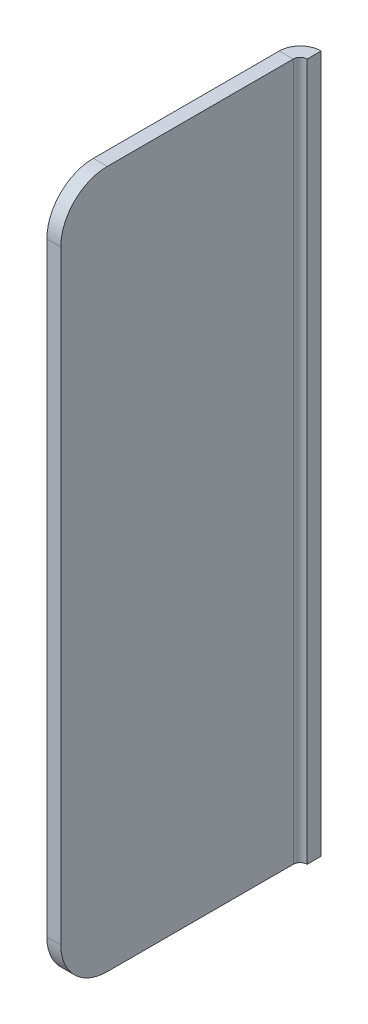
from build123d import *

# Parameters (mm, degrees)
SKETCH_3_W = 6
SKETCH_3_H = 300
FILLET_1_R = 20


with BuildPart() as part:
    # 扫描1: sweep along a path in 草图2
    with BuildLine(Plane(origin=(0, 0, 0), x_dir=(1, 0, 0), z_dir=(0, 1, 0))) as sweep_1_path:
        Line((0, 0), (0, 100))
        ThreePointArc((0, 100), (1.757359313, 104.242640687), (6, 106))
    # 草图3 → 扫描1 (sweep)
    with BuildSketch(Plane.XY):
        Rectangle(SKETCH_3_W, SKETCH_3_H)
    sweep(path=sweep_1_path.line)

    # 圆角1
    fillet_1_edges = [part.edges().sort_by_distance(p)[0] for p in [
        (0, -150, 0),
        (0, 150, 0),
    ]]
    fillet(fillet_1_edges, radius=FILLET_1_R)


solid = part.part
